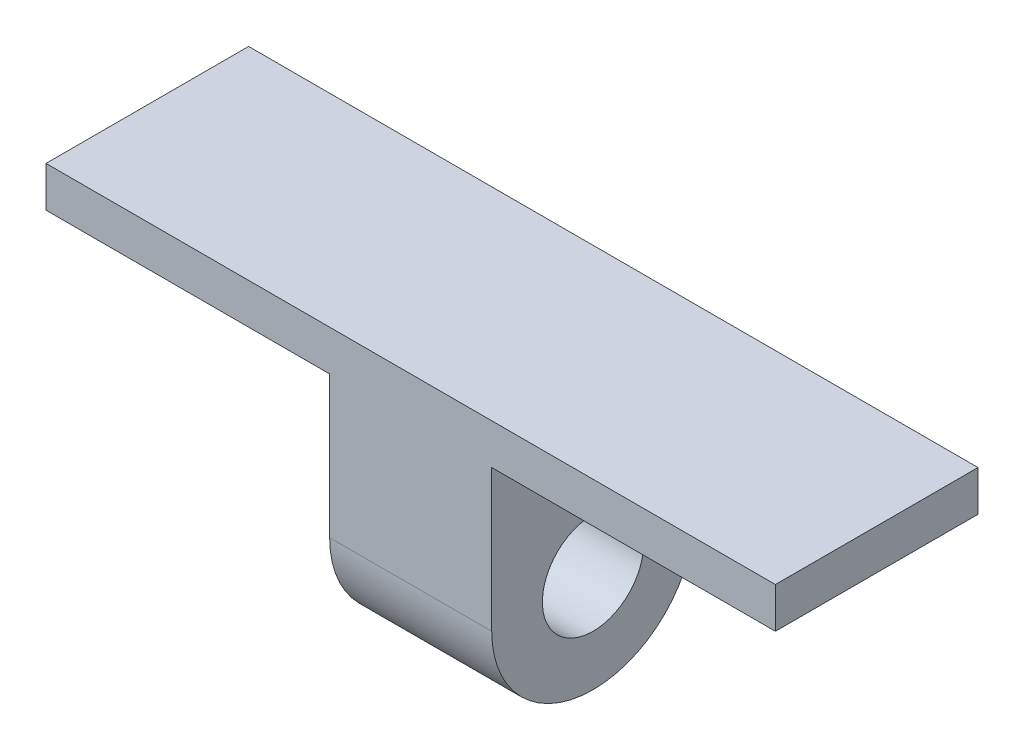
from build123d import *

# Parameters (mm, degrees)
SKETCH_1_W          = 180
SKETCH_1_H          = 50
EXTRUDE_1_DEPTH     = 10
SKETCH_2_W          = 40
SKETCH_2_H          = 50
EXTRUDE_2_DEPTH     = 60
FILLET_1_R          = 25
SKETCH_3_R          = 12.5
CUT_EXTRUDE_2_DEPTH = 135.907375632


with BuildPart() as part:
    # 草图1 → 凸台-拉伸1 (new body)
    with BuildSketch(Plane(origin=(0, 0, 0), x_dir=(1, 0, 0), z_dir=(0, 1, 0))):
        with Locations((90, -25)):
            Rectangle(SKETCH_1_W, SKETCH_1_H)
    extrude(amount=EXTRUDE_1_DEPTH)

    # 草图2 → 凸台-拉伸2 (add)
    with BuildSketch(Plane.XZ):
        with Locations((90, 25)):
            Rectangle(SKETCH_2_W, SKETCH_2_H)
    extrude(amount=EXTRUDE_2_DEPTH)

    # 圆角1
    fillet_1_edges = [part.edges().sort_by_distance(p)[0] for p in [
        (90, -60, 50),
        (90, -60, 0),
    ]]
    fillet(fillet_1_edges, radius=FILLET_1_R - 0.0001)  # a hair under: the kernel refuses the full size

    # 草图3 → 切除-拉伸2 (cut, through all)
    with BuildSketch(Plane(origin=(110, 0, 0), x_dir=(0, 0, -1), z_dir=(1, 0, 0))):
        with Locations((-25, -35)):
            Circle(SKETCH_3_R)
    extrude(amount=-CUT_EXTRUDE_2_DEPTH, mode=Mode.SUBTRACT)


solid = part.part
